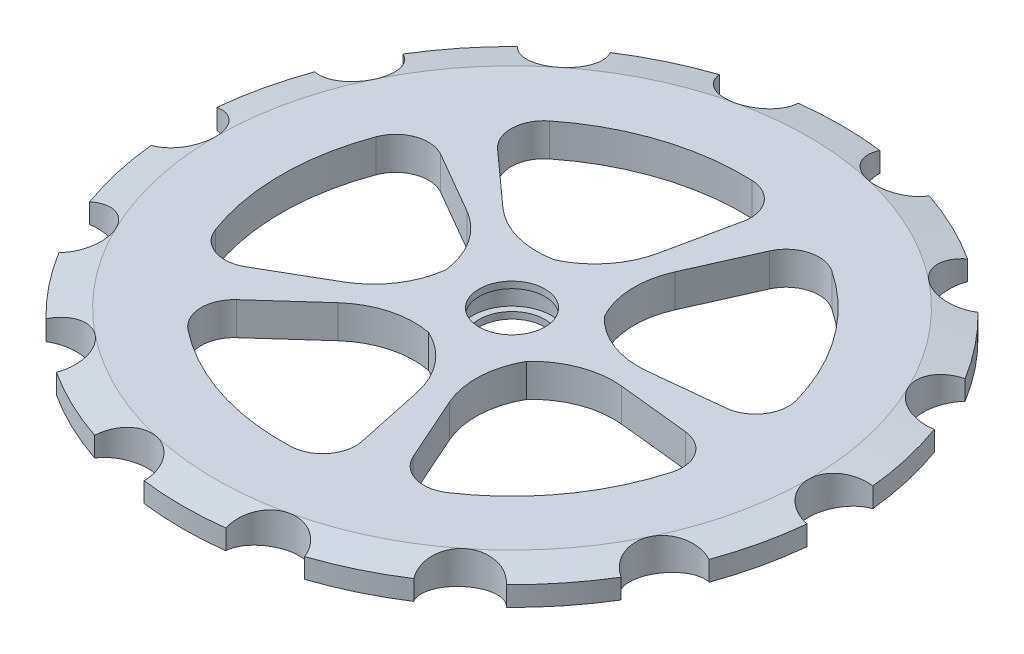
from build123d import *
from build123d.topology import SkipClean

# Parameters (mm, degrees)
SKETCH_4_W                       = 10
SKETCH_4_H                       = 10
PATTERN_CIRCULAR_1_COUNT         = 14
SKETCH_5_W                       = 50
SKETCH_5_H                       = 10
CUT_REVOLVE_3_ANGLE              = 60
FILLET_2_R                       = 25
FILLET_3_R                       = 10
PATTERN_CIRCULAR_3_COUNT         = 5
FILLET_2_OF_PATTERN_CIRCULAR_3_R = 25
FILLET_3_OF_PATTERN_CIRCULAR_3_R = 10


with BuildPart() as part:
    # Эскиз1 → Повернуть1 (revolve)
    with BuildSketch(Plane.XY, mode=Mode.PRIVATE) as revolve_1_sk:
        Polygon((0, 0), (0, 10), (90, 10), (100, 8), (100, 2), (90, 0), align=None)
    revolve(revolve_1_sk.sketch.rotate(Axis((0, 0, 0), (0, 1, 0)), 90), axis=Axis((0, 0, 0), (0, 1, 0)))

    # Эскиз3 → Вырез-Повернуть1 (revolve, cut)
    with BuildSketch(Plane.XY, mode=Mode.PRIVATE) as cut_revolve_1_sk:
        Polygon((-10, 8), (-12, 8), (-12, 2), (-10, 2), (-10, 0), (0, 0), (0, 10), (-10, 10), align=None)
    revolve(cut_revolve_1_sk.sketch.rotate(Axis((0, 0, 0), (0, 1, 0)), 270), axis=Axis((0, 0, 0), (0, 1, 0)), mode=Mode.SUBTRACT)

    # Эскиз4 → Вырез-Повернуть2 (revolve, cut)
    with SkipClean():  # the faces are left unmerged after this step: merging them gives an invalid solid
        with BuildSketch(Plane.XY):
            with Locations((-95, 5)):
                Rectangle(SKETCH_4_W, SKETCH_4_H)
        cut_revolve_2 = revolve(axis=Axis((-100, 0, 0), (0, 1, 0)), mode=Mode.SUBTRACT)

    # Круговой массив1: Вырез-Повернуть2 ×14 about axis
    pattern_circular_1_axis = Axis((0, 0, 0), (0, 1, 0))
    for i in range(1, PATTERN_CIRCULAR_1_COUNT):
        add(cut_revolve_2.rotate(pattern_circular_1_axis, i * 360 / PATTERN_CIRCULAR_1_COUNT), mode=Mode.SUBTRACT)

    # Эскиз5 → Вырез-Повернуть3 (revolve, symmetric, cut)
    with BuildSketch(Plane.XY) as cut_revolve_3_sk:
        with Locations((-45, 5)):
            Rectangle(SKETCH_5_W, SKETCH_5_H)
    cut_revolve_3 = revolve(axis=Axis((0, 0, 0), (0, 1, 0)), revolution_arc=CUT_REVOLVE_3_ANGLE / 2, mode=Mode.SUBTRACT)
    cut_revolve_3 = cut_revolve_3 + revolve(cut_revolve_3_sk.sketch, axis=Axis((0, 0, 0), (0, -1, 0)), revolution_arc=CUT_REVOLVE_3_ANGLE / 2, mode=Mode.SUBTRACT)

    # Скругление2
    # the kernel refuses this fillet: 25 mm, written as the material it adds along each edge
    with BuildSketch(Plane(origin=(-17.320508076, 10, -10), x_dir=(-0.8660254037844379, 0, -0.5000000000000011), z_dir=(0, -1, 0))) as fillet_2_piece_1:
        with BuildLine():
            CenterArc((17.416573868, -25), FILLET_2_R, 90, 56.251011404)
            ThreePointArc((-3.370411614, -11.111111111), (-0.861142044, -5.805524623), (0, 0))
            Line((0, 0), (17.416573868, 0))
        make_face()
    extrude(amount=10)
    with BuildSketch(Plane(origin=(-17.320508076, 10, 10), x_dir=(-0.22708485862533176, 0, -0.9738749750266269), z_dir=(0, -1, 0))) as fillet_2_piece_2:
        with BuildLine():
            CenterArc((18.867955023, -23.923572445), FILLET_2_R, 106.874494298, 56.251011404)
            Line((-5.055617422, -16.666666667), (0, 0))
            ThreePointArc((0, 0), (5.805524623, -0.861142044), (11.611049245, 0))
        make_face()
    extrude(amount=10)

    # Скругление3
    fillet_3_edges = [part.edges().sort_by_distance(p)[0] for p in [
        (-60.621778265, 5, -35),
        (-60.621778265, 5, 35),
    ]]
    fillet(fillet_3_edges, radius=FILLET_3_R)

    # Круговой массив3: Вырез-Повернуть3 ×5 about axis
    pattern_circular_3_axis = Axis((0, 0, 0), (0, 1, 0))
    for i in range(1, PATTERN_CIRCULAR_3_COUNT):
        add(cut_revolve_3.rotate(pattern_circular_3_axis, i * 360 / PATTERN_CIRCULAR_3_COUNT), mode=Mode.SUBTRACT)

    # Скругление2 of Круговой массив3
    # the kernel refuses this fillet: 25 mm, written as the material it adds along each edge
    with BuildSketch(Plane(origin=(-14.86289651, 10, 13.382612127), x_dir=(0.8560370605753937, 0, 0.5169144522272902), z_dir=(0, -1, 0)), Plane(origin=(8.134732862, 10, 18.270909153), x_dir=(0.7561448576904768, 0, -0.6544042742741283), z_dir=(0, -1, 0)), Plane(origin=(19.890437907, 10, -2.090569265), x_dir=(-0.38871383810422583, 0, -0.92135853611191), z_dir=(0, -1, 0)), Plane(origin=(4.158233816, 10, -19.562952015), x_dir=(-0.9963832215363133, 0, 0.08497338313211929), z_dir=(0, -1, 0))) as fillet_2_of_pattern_circular_3_piece_1:
        with BuildLine():
            CenterArc((18.867955023, 23.923572445), FILLET_2_OF_PATTERN_CIRCULAR_3_R, 196.874494298, 56.251011404)
            Line((-5.055617422, 16.666666667), (0, 0))
            ThreePointArc((0, 0), (5.805524623, 0.861142044), (11.611049245, 0))
        make_face()
    extrude(amount=10)
    with BuildSketch(Plane(origin=(4.158233816, 10, 19.562952015), x_dir=(0.2079116908177606, 0, 0.9781476007338052), z_dir=(0, -1, 0)), Plane(origin=(19.890437907, 10, 2.090569265), x_dir=(0.9945218953682734, 0, 0.10452846326765218), z_dir=(0, -1, 0)), Plane(origin=(8.134732862, 10, -18.270909153), x_dir=(0.40673664307579904, 0, -0.9135454576426015), z_dir=(0, -1, 0)), Plane(origin=(-14.86289651, 10, -13.382612127), x_dir=(-0.743144825477395, 0, -0.6691306063588572), z_dir=(0, -1, 0))) as fillet_2_of_pattern_circular_3_piece_2:
        with BuildLine():
            CenterArc((17.416573868, 25), FILLET_2_OF_PATTERN_CIRCULAR_3_R, 213.748988596, 56.251011404)
            ThreePointArc((-3.370411614, 11.111111111), (-0.861142044, 5.805524623), (0, 0))
            Line((0, 0), (17.416573868, 0))
        make_face()
    extrude(amount=10)

    # Скругление3 of Круговой массив3
    fillet_3_of_pattern_circular_3_edges = [part.edges().sort_by_distance(p)[0] for p in [
        (-52.020137783, 5, 46.839142445),
        (14.553818357, 5, 68.470332051),
        (28.471565015, 5, 63.948182035),
        (69.616532676, 5, 7.316992429),
        (69.616532676, 5, -7.316992429),
        (28.471565015, 5, -63.948182035),
        (14.553818357, 5, -68.470332051),
        (-52.020137783, 5, -46.839142445),
    ]]
    fillet(fillet_3_of_pattern_circular_3_edges, radius=FILLET_3_OF_PATTERN_CIRCULAR_3_R)


solid = part.part
